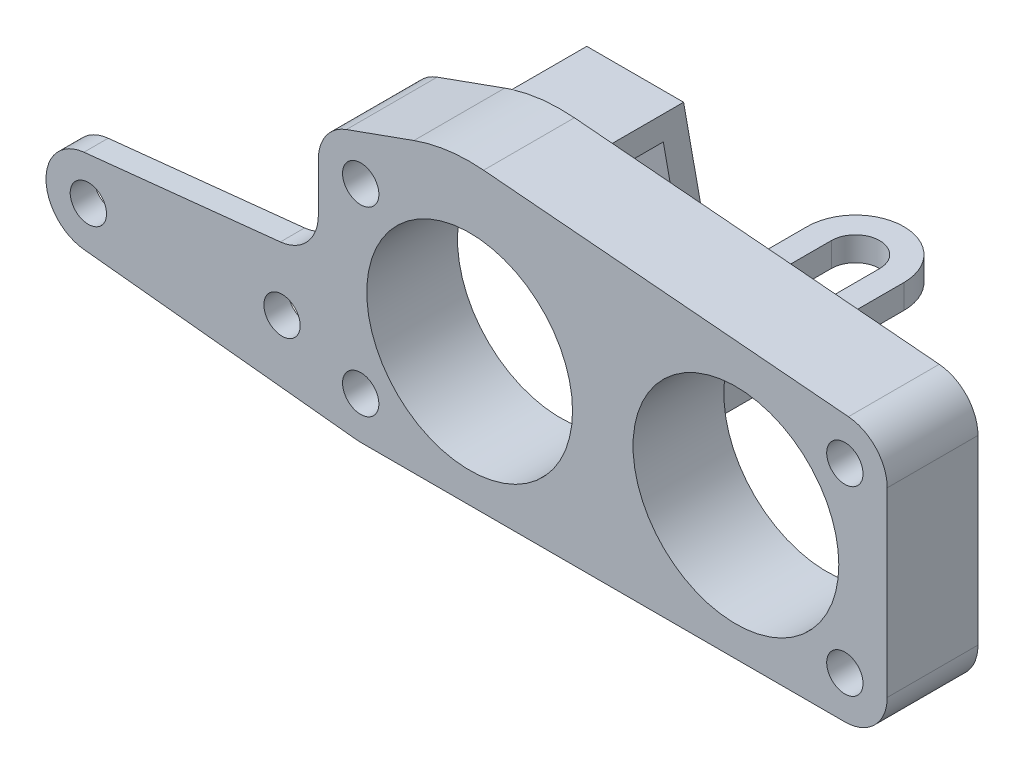
from build123d import *

# Parameters (mm, degrees)
SKETCH1_R           = 8.5
SKETCH1_R_2         = 1.5
BOSS_EXTRUDE1_DEPTH = 7.5
BOSS_EXTRUDE2_START = -2
SKETCH2_R           = 1.5
BOSS_EXTRUDE2_DEPTH = 2
EXTRUDE_THIN1_DEPTH = 4
BOSS_EXTRUDE3_START = -7.5
BOSS_EXTRUDE3_DEPTH = 7.5
CUT_EXTRUDE1_DEPTH  = 10
FILLET1_R           = 4


with BuildPart() as part:
    # Sketch1 → Boss-Extrude1 (new body)
    with BuildSketch(Plane.XY):
        with BuildLine():
            Line((-12.5, -7.5), (-12.5, 7.5))
            ThreePointArc((-12.5, 7.5), (-11.474873734, 9.974873734), (-9, 11))
            Line((-9, 11), (31, 11))
            ThreePointArc((31, 11), (33.474873734, 9.974873734), (34.5, 7.5))
            Line((34.5, 7.5), (34.5, -7.5))
            ThreePointArc((34.5, -7.5), (33.474873734, -9.974873734), (31, -11))
            Line((31, -11), (-9, -11))
            ThreePointArc((-9, -11), (-11.474873734, -9.974873734), (-12.5, -7.5))
        make_face()
        Circle(SKETCH1_R, mode=Mode.SUBTRACT)
        with Locations((22, 0)):
            Circle(SKETCH1_R, mode=Mode.SUBTRACT)
        with Locations((-9, 7.5)):
            Circle(SKETCH1_R_2, mode=Mode.SUBTRACT)
        with Locations((31, 7.5)):
            Circle(SKETCH1_R_2, mode=Mode.SUBTRACT)
        with Locations((31, -7.5)):
            Circle(SKETCH1_R_2, mode=Mode.SUBTRACT)
        with Locations((-9, -7.5)):
            Circle(SKETCH1_R_2, mode=Mode.SUBTRACT)
    extrude(amount=BOSS_EXTRUDE1_DEPTH)

    # Sketch2 → Boss-Extrude2 (add)
    with BuildSketch(Plane.XY.offset(7.5).offset(BOSS_EXTRUDE2_START)):
        with BuildLine():
            ThreePointArc((-12.5, 3.506965576), (-13.399757461, 1.164159836), (-15.636422136, 0.025900921))
            Line((-15.636422136, 0.025900921), (-31.863577864, -1.668935344))
            ThreePointArc((-31.863577864, -1.668935344), (-35, -5.15), (-31.863577864, -8.631064656))
            Line((-31.863577864, -8.631064656), (-9.363577864, -10.981064656))
            ThreePointArc((-9.363577864, -10.981064656), (-11.600242539, -9.842805741), (-12.5, -7.5))
            Line((-12.5, -7.5), (-12.5, 3.506965576))
        make_face()
        with Locations((-31.5, -5.15)):
            Circle(SKETCH2_R, mode=Mode.SUBTRACT)
        with Locations((-15.5, -5.15)):
            Circle(SKETCH2_R, mode=Mode.SUBTRACT)
    extrude(amount=BOSS_EXTRUDE2_DEPTH)

    # Sketch3 → Extrude-Thin1 (add, symmetric)
    with BuildSketch(Plane(origin=(0, 0, 0), x_dir=(0, 0, -1), z_dir=(1, 0, 0))):
        Polygon((-7.5, 11), (4.5, 11), (8.379193576, -11), (28.379193576, -11), (28.379193576, -9), (10.057392838, -9), (6.178199262, 13), (-7.5, 13), align=None)
    extrude(amount=EXTRUDE_THIN1_DEPTH, both=True)

    # Sketch4 → Boss-Extrude3 (add)
    with BuildSketch(Plane.XY.offset(7.5).offset(BOSS_EXTRUDE3_START)):
        with BuildLine():
            Line((-4.599183693, 12.800293331), (-10.183485485, 10.793836988))
            ThreePointArc((-10.183485485, 10.793836988), (-9.600654035, 10.948074061), (-9, 11))
            Line((-9, 11), (-4, 11))
            Line((-4, 11), (-4, 13))
            ThreePointArc((-4, 13), (-4.300751183, 12.903625044), (-4.599183693, 12.800293331))
        make_face()
        with BuildLine():
            ThreePointArc((1.153263837, 13.552489901), (-1.449926884, 13.523968058), (-4, 13))
            Line((-4, 13), (4, 13))
            Line((4, 13), (4, 11))
            Line((4, 11), (31, 11))
            ThreePointArc((31, 11), (31.148515642, 10.996847595), (31.296763753, 10.987396059))
            Line((31.296763753, 10.987396059), (1.153263837, 13.552489901))
        make_face()
    extrude(amount=BOSS_EXTRUDE3_DEPTH)

    # Sketch5 → Cut-Extrude1 (cut)
    with BuildSketch(Plane(origin=(0, -9, 0), x_dir=(1, 0, 0), z_dir=(0, 1, 0))):
        with BuildLine():
            Line((2, 24.379193576), (2, 14.057392838))
            ThreePointArc((2, 14.057392838), (0, 12.057392838), (-2, 14.057392838))
            Line((-2, 14.057392838), (-2, 24.379193576))
            ThreePointArc((-2, 24.379193576), (0, 26.379193576), (2, 24.379193576))
        make_face()
    extrude(amount=-CUT_EXTRUDE1_DEPTH, mode=Mode.SUBTRACT)

    # Fillet1
    fillet1_edges = [part.edges().sort_by_distance(p)[0] for p in [
        (-4, -10, -28.379193576),
        (4, -10, -28.379193576),
    ]]
    fillet(fillet1_edges, radius=FILLET1_R - 0.0001)  # a hair under: the kernel refuses the full size


solid = part.part
